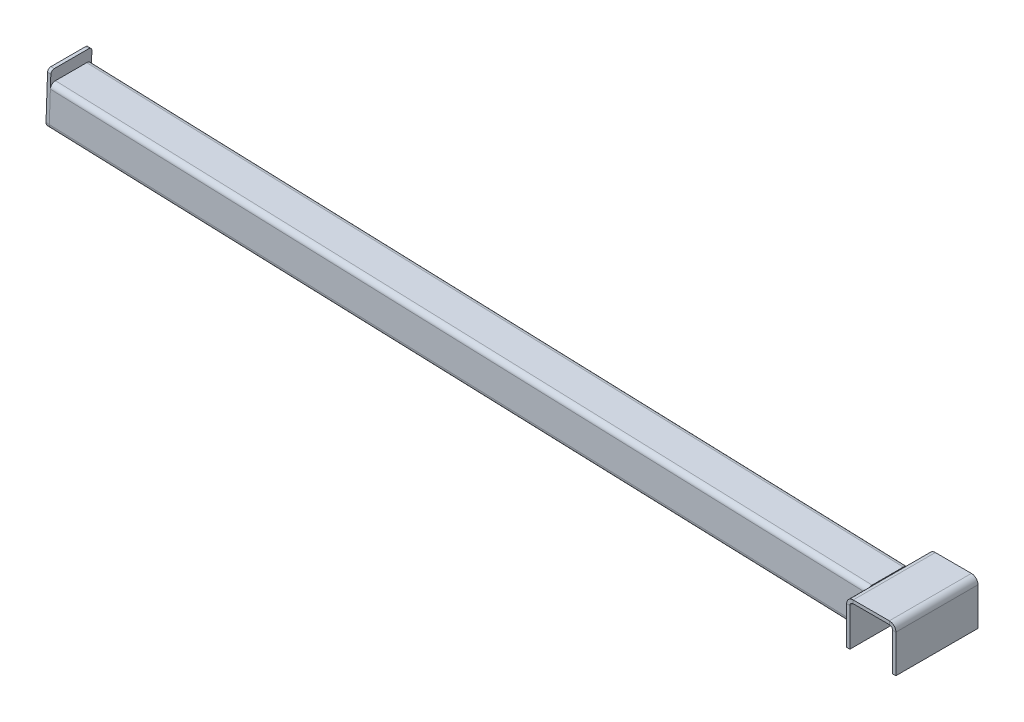
from build123d import *

# Parameters (mm, degrees)
SKETCH_1_W                     = 26
SKETCH_1_H                     = 50
SM_BASE_FLANGE_1_DEPTH         = 2
EDGE_FLANGE1_STRIP_W           = 12
EDGE_FLANGE1_STRIP_H           = 2
EDGE_FLANGE1_STRIP_CUT_DEPTH   = 50
EDGE_FLANGE1_STRIP_2_W         = 12
EDGE_FLANGE1_STRIP_2_H         = 2
EDGE_FLANGE1_STRIP_CUT_2_DEPTH = 50
EDGE_FLANGE1_DEPTH             = 50
EDGE_FLANGE1_BEND_DEPTH        = 50
F_2_X_2_X_0_25_1_DEPTH         = 500
SKETCH_15_W                    = 53.141638299
SKETCH_15_H                    = 32.279440364
CUT_EXTRUDE_1_DEPTH            = 500.488886686
EXTRUDE_2_DEPTH                = 2


# Sheet-metal steps are written as plain solids
with BuildPart() as part:
    # Эскиз1 → Базовая кромка1 (new body)
    with BuildSketch(Plane(origin=(0, 0, 0), x_dir=(1, 0, 0), z_dir=(0, 1, 0))):
        Rectangle(SKETCH_1_W, SKETCH_1_H)
    extrude(amount=-SM_BASE_FLANGE_1_DEPTH)

    # Edge-Flange1 strip (across the edge) → Edge-Flange1 strip cut (cut)
    with BuildSketch(Plane(origin=(13, -2, -25), x_dir=(-1, 0, 0), z_dir=(0, 0, 1))):
        with Locations((-4, -1)):
            Rectangle(EDGE_FLANGE1_STRIP_W, EDGE_FLANGE1_STRIP_H)
    extrude(amount=EDGE_FLANGE1_STRIP_CUT_DEPTH, mode=Mode.SUBTRACT)

    # Edge-Flange1 strip 2 (across the edge) → Edge-Flange1 strip cut 2 (cut)
    with BuildSketch(Plane(origin=(-13, -2, 25), x_dir=(1, 0, 0), z_dir=(0, 0, -1))):
        with Locations((-4, -1)):
            Rectangle(EDGE_FLANGE1_STRIP_2_W, EDGE_FLANGE1_STRIP_2_H)
    extrude(amount=EDGE_FLANGE1_STRIP_CUT_2_DEPTH, mode=Mode.SUBTRACT)

    # Edge-Flange1 section (across the edge) → Edge-Flange1 (add)
    with BuildSketch(Plane(origin=(13, -2, -25), x_dir=(-1, 0, 0), z_dir=(0, 0, 1))):
        with BuildLine():
            Line((-2, 2), (-2, 25))
            Line((-2, 25), (0, 25))
            Line((0, 25), (0, 2))
            ThreePointArc((0, 2), (0.585786438, 0.585786438), (2, 0))
            Line((2, 0), (2, -2))
            ThreePointArc((2, -2), (-0.828427125, -0.828427125), (-2, 2))
        make_face()
    extrude(amount=EDGE_FLANGE1_DEPTH)

    # Edge-Flange1 section 2 (across the edge) → Edge-Flange1 bend (add)
    with BuildSketch(Plane(origin=(-13, -2, 25), x_dir=(1, 0, 0), z_dir=(0, 0, -1))):
        with BuildLine():
            Line((-2, 2), (-2, 25))
            Line((-2, 25), (0, 25))
            Line((0, 25), (0, 2))
            ThreePointArc((0, 2), (0.585786438, 0.585786438), (2, 0))
            Line((2, 0), (2, -2))
            ThreePointArc((2, -2), (-0.828427125, -0.828427125), (-2, 2))
        make_face()
    extrude(amount=EDGE_FLANGE1_BEND_DEPTH)


with BuildPart() as body_2:
    # Sketch1 → Квадратная труба 2 X 2 X 0.25(1) (new body)
    with BuildSketch(Plane(origin=(-13, -14.5, 0), x_dir=(-0.03489949670250092, -0.9993908270190959, 0), z_dir=(-0.9993908270190959, 0.03489949670250092, 0))):
        with BuildLine():
            Line((-9.5, -12.5), (9.5, -12.5))
            ThreePointArc((9.5, -12.5), (11.621320344, -11.621320344), (12.5, -9.5))
            Line((12.5, -9.5), (12.5, 9.5))
            ThreePointArc((12.5, 9.5), (11.621320344, 11.621320344), (9.5, 12.5))
            Line((9.5, 12.5), (-9.5, 12.5))
            ThreePointArc((-9.5, 12.5), (-11.621320344, 11.621320344), (-12.5, 9.5))
            Line((-12.5, 9.5), (-12.5, -9.5))
            ThreePointArc((-12.5, -9.5), (-11.621320344, -11.621320344), (-9.5, -12.5))
        make_face()
        with BuildLine():
            Line((-9.5, -11), (9.5, -11))
            ThreePointArc((9.5, -11), (10.560660172, -10.560660172), (11, -9.5))
            Line((11, -9.5), (11, 9.5))
            ThreePointArc((11, 9.5), (10.560660172, 10.560660172), (9.5, 11))
            Line((9.5, 11), (-9.5, 11))
            ThreePointArc((-9.5, 11), (-10.560660172, 10.560660172), (-11, 9.5))
            Line((-11, 9.5), (-11, -9.5))
            ThreePointArc((-11, -9.5), (-10.560660172, -10.560660172), (-9.5, -11))
        make_face(mode=Mode.SUBTRACT)
    extrude(amount=F_2_X_2_X_0_25_1_DEPTH)

    # Эскиз15 → Вырез-Вытянуть1 (cut, through all)
    with BuildSketch(Plane.ZY.offset(15)):
        with Locations((-5.765575738, -15.221763434)):
            Rectangle(SKETCH_15_W, SKETCH_15_H)
    extrude(amount=-CUT_EXTRUDE_1_DEPTH, mode=Mode.SUBTRACT)


with BuildPart() as body_3:
    # Эскиз16 → Бобышка-Вытянуть2 (new body)
    with BuildSketch(Plane(origin=(-512.173845402, 17.885504795, 0), x_dir=(0, 0, 1), z_dir=(-0.9993908270190958, 0.034899496702500934, 0))):
        with BuildLine():
            Line((-10.5, 4.555139551), (10.5, 4.555139551))
            ThreePointArc((10.5, 4.555139551), (11.914213562, 3.969353113), (12.5, 2.555139551))
            Line((12.5, 2.555139551), (12.5, -24.444860449))
            ThreePointArc((12.5, -24.444860449), (11.621320344, -26.566180792), (9.5, -27.444860449))
            Line((9.5, -27.444860449), (-9.5, -27.444860449))
            ThreePointArc((-9.5, -27.444860449), (-11.621320344, -26.566180792), (-12.5, -24.444860449))
            Line((-12.5, -24.444860449), (-12.5, 2.555139551))
            ThreePointArc((-12.5, 2.555139551), (-11.914213562, 3.969353113), (-10.5, 4.555139551))
        make_face()
    extrude(amount=EXTRUDE_2_DEPTH)


solid = Compound([part.part, body_2.part, body_3.part])
